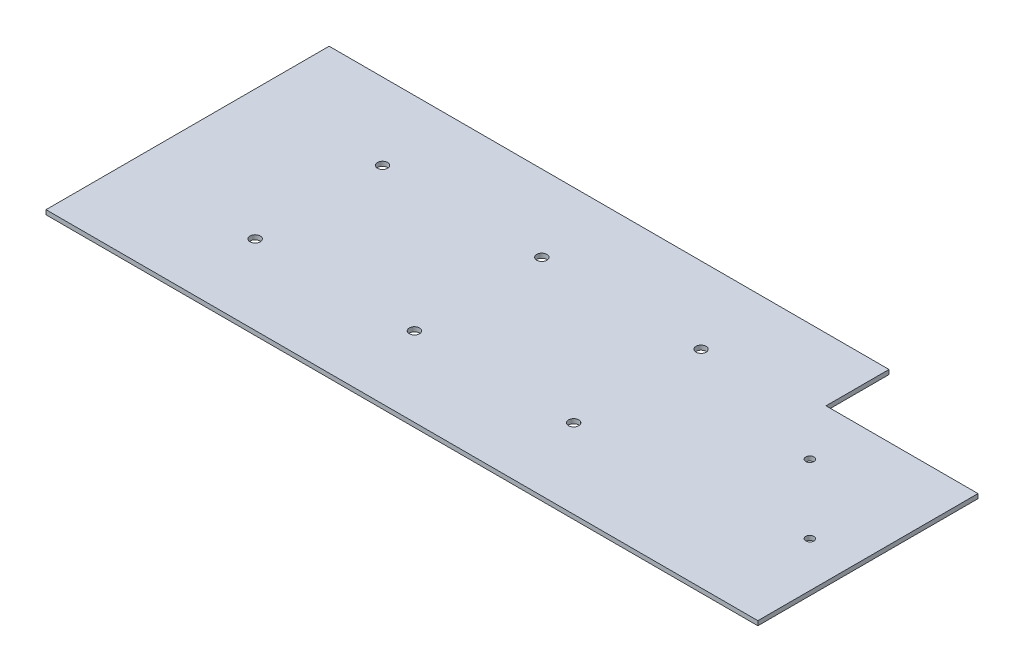
from build123d import *

# Parameters (mm, degrees)
BOSS_EXTRUDE1_DEPTH     = 3.5
CUT_EXTRUDE1_DEPTH      = 602.385693628
CUT_EXTRUDE1_DEPTH_BACK = 602.385693628
SKETCH2_R               = 4
SKETCH3_R               = 3.175
CUT_EXTRUDE2_DEPTH      = 10


with BuildPart() as part:
    # Sketch1 → Boss-Extrude1 (new body)
    with BuildSketch(Plane(origin=(0, 0, 0), x_dir=(1, 0, 0), z_dir=(0, 1, 0))):
        Polygon((0, 0), (0, 222.25), (439.5, 222.25), (439.5, 172.8), (558.8, 172.8), (558.8, 0), align=None)
    extrude(amount=BOSS_EXTRUDE1_DEPTH)

    # Sketch2 → Cut-Extrude1 (cut, two sides: drawn at the far end of the back side and taken through both)
    with BuildSketch(Plane(origin=(0, 3.5, 0), x_dir=(1, 0, 0), z_dir=(0, 1, 0)).offset(-CUT_EXTRUDE1_DEPTH_BACK)):
        with Locations((101.97168799, 162.2158083)):
            Circle(SKETCH2_R)
        with Locations((226.97168799, 162.2158083)):
            Circle(SKETCH2_R)
        with Locations((351.97168799, 162.2158083)):
            Circle(SKETCH2_R)
        with Locations((351.97168799, 62.2158083)):
            Circle(SKETCH2_R)
        with Locations((226.97168799, 62.2158083)):
            Circle(SKETCH2_R)
        with Locations((101.97168799, 62.2158083)):
            Circle(SKETCH2_R)
    extrude(amount=CUT_EXTRUDE1_DEPTH + CUT_EXTRUDE1_DEPTH_BACK, mode=Mode.SUBTRACT)

    # Sketch3 → Cut-Extrude2 (cut)
    with BuildSketch(Plane(origin=(0, 3.5, 0), x_dir=(1, 0, 0), z_dir=(0, 1, 0))):
        with Locations((469.459010849, 130.139772745)):
            Circle(SKETCH3_R)
        with Locations((523.459010849, 76.139772745)):
            Circle(SKETCH3_R)
    extrude(amount=-CUT_EXTRUDE2_DEPTH, mode=Mode.SUBTRACT)


solid = part.part
